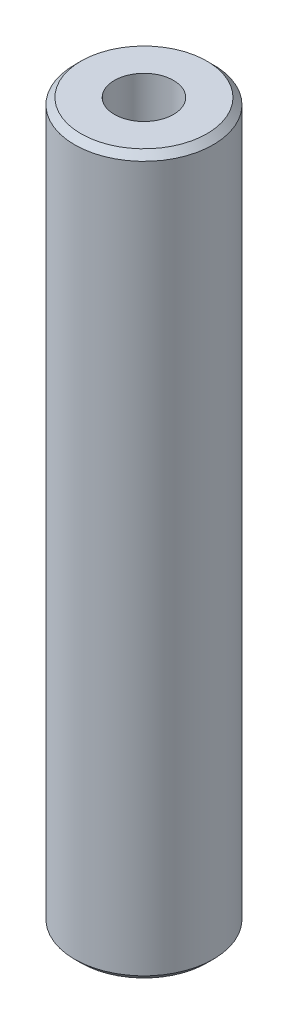
from build123d import *

# Parameters (mm, degrees)
SKETCH1_R           = 10
BOSS_EXTRUDE1_DEPTH = 103.576799097
SKETCH2_R           = 4.262875934
CUT_EXTRUDE1_DEPTH  = 105.537808047
CHAMFER1_SIZE       = 0.917478972


with BuildPart() as part:
    # Sketch1 → Boss-Extrude1 (new body)
    with BuildSketch(Plane(origin=(0, 0, 0), x_dir=(1, 0, 0), z_dir=(0, 1, 0))):
        Circle(SKETCH1_R)
    extrude(amount=BOSS_EXTRUDE1_DEPTH)

    # Sketch2 → Cut-Extrude1 (cut, through all)
    with BuildSketch(Plane(origin=(0, 0, 0), x_dir=(1, 0, 0), z_dir=(0, 1, 0))):
        Circle(SKETCH2_R)
    extrude(amount=CUT_EXTRUDE1_DEPTH, mode=Mode.SUBTRACT)

    # Chamfer1
    chamfer1_edges = [part.edges().sort_by_distance(p)[0] for p in [
        (-10, 103.576799097, 0),
        (-10, 0, 0),
    ]]
    chamfer(chamfer1_edges, length=CHAMFER1_SIZE)


solid = part.part
